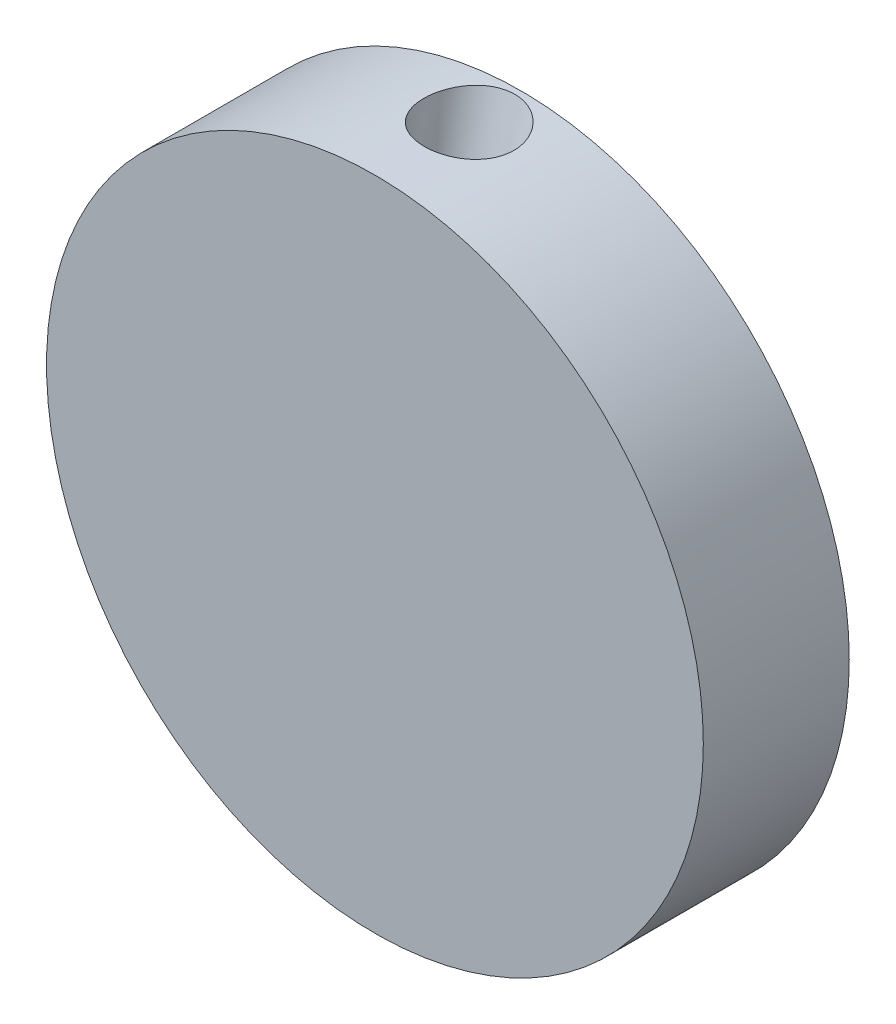
from build123d import *

# Parameters (mm, degrees)
SKETCH1_R           = 22.5
BOSS_EXTRUDE1_DEPTH = 10


with BuildPart() as part:
    # Sketch1 → Boss-Extrude1 (new body)
    with BuildSketch(Plane(origin=(0, 0, 0), x_dir=(0, 1, 0), z_dir=(0, 0, 1))):
        with Locations(Location((0, 0, 0), (0, 0, 270))):
            Circle(SKETCH1_R)
    extrude(amount=BOSS_EXTRUDE1_DEPTH)

    # Cut-Loft2: read off the stored shape, not the designer's step
    # Cut-Loft2: loft between two sections, ruled curve by curve
    cut_loft2_from = [
        Edge.make_bspline([(-3.062742519, 22.5, 3.995182606), (-3.102673733, 22.5, 3.739954063), (-3.116808131, 22.5, 3.446383899), (-3.031995261, 22.5, 2.790511537), (-2.931606201, 22.5, 2.426728682), (-2.640745029, 22.5, 1.879188932), (-2.52044876, 22.5, 1.697043211), (-2.229311291, 22.5, 1.350028778), (-2.058360385, 22.5, 1.185285355), (-1.669822979, 22.5, 0.892878816), (-1.45222816, 22.5, 0.765420496), (-0.984445001, 22.5, 0.565488339), (-0.734403106, 22.5, 0.493196738), (-0.223946019, 22.5, 0.413334311), (0.036227535, 22.5, 0.405801289), (0.542722706, 22.5, 0.453304899), (0.788849216, 22.5, 0.508212731), (1.248129809, 22.5, 0.667975792), (1.461229266, 22.5, 0.772633471), (1.844443062, 22.5, 1.014143778), (2.0146236, 22.5, 1.150843597), (2.458820633, 22.5, 1.583381452), (2.665522556, 22.5, 1.899119071), (2.946605326, 22.5, 2.497746045), (3.022811306, 22.5, 2.781604937), (3.102673733, 22.5, 3.292062024), (3.116808131, 22.5, 3.585632188), (3.031995261, 22.5, 4.241504549), (2.931606201, 22.5, 4.605287404), (2.640745029, 22.5, 5.152827155), (2.52044876, 22.5, 5.334972875), (2.229311291, 22.5, 5.681987308), (2.058360385, 22.5, 5.846730732), (1.669822979, 22.5, 6.139137271), (1.45222816, 22.5, 6.266595591), (0.984445001, 22.5, 6.466527748), (0.734403106, 22.5, 6.538819349), (0.223946019, 22.5, 6.618681776), (-0.036227535, 22.5, 6.626214798), (-0.542722706, 22.5, 6.578711188), (-0.788849216, 22.5, 6.523803355), (-1.248129809, 22.5, 6.364040295), (-1.461229266, 22.5, 6.259382616), (-1.844443062, 22.5, 6.017872308), (-2.0146236, 22.5, 5.88117249), (-2.458820633, 22.5, 5.448634635), (-2.665522556, 22.5, 5.132897016), (-2.946605326, 22.5, 4.534270042), (-3.022811306, 22.5, 4.250411149), (-3.062742519, 22.5, 3.995182606)], [0, 0, 0, 0, 0.0625, 0.0625, 0.125, 0.125, 0.15625, 0.15625, 0.1875, 0.1875, 0.21875, 0.21875, 0.25, 0.25, 0.28125, 0.28125, 0.3125, 0.3125, 0.34375, 0.34375, 0.375, 0.375, 0.4375, 0.4375, 0.5, 0.5, 0.5625, 0.5625, 0.625, 0.625, 0.65625, 0.65625, 0.6875, 0.6875, 0.71875, 0.71875, 0.75, 0.75, 0.78125, 0.78125, 0.8125, 0.8125, 0.84375, 0.84375, 0.875, 0.875, 0.9375, 0.9375, 1, 1, 1, 1], 3),
    ]
    cut_loft2_to = [
        Edge.make_bspline([(-2.481098276, 6.5, 5.73426752), (-2.372952563, 6.5, 5.52750933), (-2.225476335, 6.5, 5.306774985), (-1.811493158, 6.5, 4.876164906), (-1.543143857, 6.5, 4.665988865), (-1.037772293, 6.5, 4.424742969), (-0.851641147, 6.5, 4.357362517), (-0.453807073, 6.5, 4.261926778), (-0.242104145, 6.5, 4.233871489), (0.197097356, 6.5, 4.230341545), (0.423561643, 6.5, 4.254719262), (0.870610273, 6.5, 4.360907727), (1.090990377, 6.5, 4.442772096), (1.504506757, 6.5, 4.659063524), (1.697447285, 6.5, 4.793388196), (2.039652165, 6.5, 5.100021997), (2.188844069, 6.5, 5.272132782), (2.43645178, 6.5, 5.634901084), (2.534156402, 6.5, 5.824793252), (2.682679055, 6.5, 6.206003105), (2.733497087, 6.5, 6.39732079), (2.82358911, 6.5, 6.950026342), (2.804011262, 6.5, 7.290323306), (2.686436626, 6.5, 7.875971081), (2.58924399, 6.5, 8.123006464), (2.372952563, 6.5, 8.536522843), (2.225476335, 6.5, 8.757257189), (1.811493158, 6.5, 9.187867268), (1.543143857, 6.5, 9.398043309), (1.037772293, 6.5, 9.639289205), (0.851641147, 6.5, 9.706669656), (0.453807073, 6.5, 9.802105396), (0.242104145, 6.5, 9.830160684), (-0.197097356, 6.5, 9.833690628), (-0.423561643, 6.5, 9.809312911), (-0.870610273, 6.5, 9.703124446), (-1.090990377, 6.5, 9.621260077), (-1.504506757, 6.5, 9.404968649), (-1.697447285, 6.5, 9.270643977), (-2.039652165, 6.5, 8.964010176), (-2.188844069, 6.5, 8.791899391), (-2.43645178, 6.5, 8.429131089), (-2.534156402, 6.5, 8.239238921), (-2.682679055, 6.5, 7.858029068), (-2.733497087, 6.5, 7.666711383), (-2.82358911, 6.5, 7.114005831), (-2.804011262, 6.5, 6.773708867), (-2.686436626, 6.5, 6.188061093), (-2.58924399, 6.5, 5.94102571), (-2.481098276, 6.5, 5.73426752)], [0, 0, 0, 0, 0.0625, 0.0625, 0.125, 0.125, 0.15625, 0.15625, 0.1875, 0.1875, 0.21875, 0.21875, 0.25, 0.25, 0.28125, 0.28125, 0.3125, 0.3125, 0.34375, 0.34375, 0.375, 0.375, 0.4375, 0.4375, 0.5, 0.5, 0.5625, 0.5625, 0.625, 0.625, 0.65625, 0.65625, 0.6875, 0.6875, 0.71875, 0.71875, 0.75, 0.75, 0.78125, 0.78125, 0.8125, 0.8125, 0.84375, 0.84375, 0.875, 0.875, 0.9375, 0.9375, 1, 1, 1, 1], 3),
    ]
    cut_loft2 = Solid(Shell([*[Face.make_surface_from_curves(cut_loft2_from[k], cut_loft2_to[k]) for k in range(1)], Face(Wire(cut_loft2_from)), Face(Wire(cut_loft2_to))]))
    add(cut_loft2, mode=Mode.SUBTRACT)


solid = part.part
